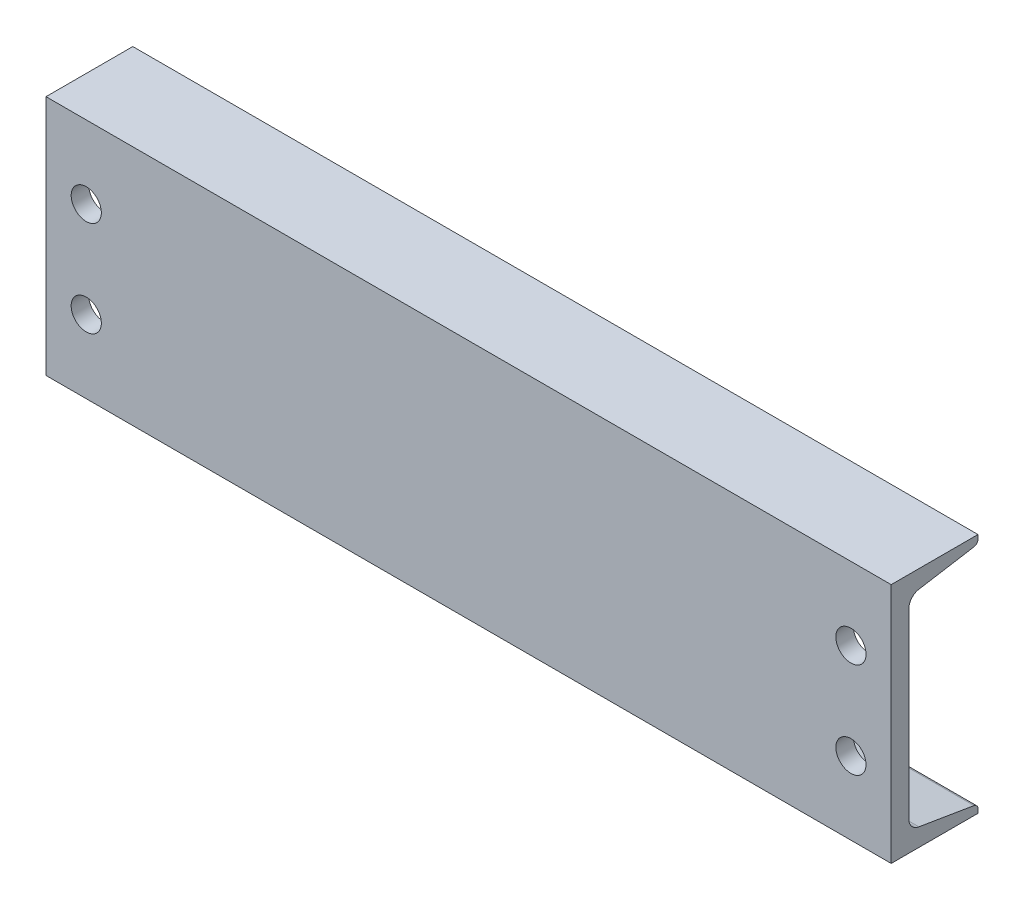
from build123d import *

# Parameters (mm, degrees)
BOSS_EXTRUDE1_DEPTH = 266.7
CUT_EXTRUDE1_REACH  = 284.731
SKETCH2_R           = 9.525
CUT_EXTRUDE2_REACH  = 310.391
SKETCH3_R           = 9.525


with BuildPart() as part:
    # Sketch1 → Boss-Extrude1 (new, symmetric)
    with BuildSketch(Plane(origin=(0, 0, 0), x_dir=(0, 0, -1), z_dir=(1, 0, 0))):
        with BuildLine():
            Line((-27.3939, -76.2), (-27.3939, 76.2))
            Line((-27.3939, 76.2), (27.3939, 76.2))
            Line((27.3939, 76.2), (27.3939, 73.710744653))
            ThreePointArc((27.3939, 73.710744653), (26.67159656, 71.740607726), (24.84702368, 70.704221901))
            Line((24.84702368, 70.704221901), (-9.926909199, 64.908143628))
            ThreePointArc((-9.926909199, 64.908143628), (-14.488341399, 62.317179067), (-16.2941, 57.391836749))
            Line((-16.2941, 57.391836749), (-16.2941, -57.391836749))
            ThreePointArc((-16.2941, -57.391836749), (-14.488341399, -62.317179067), (-9.926909199, -64.908143628))
            Line((-9.926909199, -64.908143628), (24.84702368, -70.704221901))
            ThreePointArc((24.84702368, -70.704221901), (26.67159656, -71.740607726), (27.3939, -73.710744653))
            Line((27.3939, -73.710744653), (27.3939, -76.2))
            Line((27.3939, -76.2), (-27.3939, -76.2))
        make_face()
    extrude(amount=BOSS_EXTRUDE1_DEPTH, both=True)

    # Sketch2 → Cut-Extrude1 (cut, up to next)
    with BuildSketch(Plane.XY.offset(27.3939), mode=Mode.PRIVATE) as cut_extrude1_sk1:
        with Locations((-241.3, 30.1625)):
            Circle(SKETCH2_R)
    cut_extrude1_tool1 = extrude(cut_extrude1_sk1.sketch, amount=-CUT_EXTRUDE1_REACH, mode=Mode.PRIVATE) & part.part
    # Sketch2 → Cut-Extrude1 (cut, up to next)
    with BuildSketch(Plane.XY.offset(27.3939), mode=Mode.PRIVATE) as cut_extrude1_sk2:
        with Locations((-241.3, -30.1625)):
            Circle(SKETCH2_R)
    cut_extrude1_tool2 = extrude(cut_extrude1_sk2.sketch, amount=-CUT_EXTRUDE1_REACH, mode=Mode.PRIVATE) & part.part
    # Sketch2 → Cut-Extrude1 (cut, up to next)
    with BuildSketch(Plane.XY.offset(27.3939), mode=Mode.PRIVATE) as cut_extrude1_sk3:
        with Locations((241.3, -30.1625)):
            Circle(SKETCH2_R)
    cut_extrude1_tool3 = extrude(cut_extrude1_sk3.sketch, amount=-CUT_EXTRUDE1_REACH, mode=Mode.PRIVATE) & part.part
    # Sketch2 → Cut-Extrude1 (cut, up to next)
    with BuildSketch(Plane.XY.offset(27.3939), mode=Mode.PRIVATE) as cut_extrude1_sk4:
        with Locations((241.3, 30.1625)):
            Circle(SKETCH2_R)
    cut_extrude1_tool4 = extrude(cut_extrude1_sk4.sketch, amount=-CUT_EXTRUDE1_REACH, mode=Mode.PRIVATE) & part.part
    add(cut_extrude1_tool1.solids().sort_by_distance((-241.3, 30.1625, 27.3939))[0], mode=Mode.SUBTRACT)
    add(cut_extrude1_tool2.solids().sort_by_distance((-241.3, -30.1625, 27.3939))[0], mode=Mode.SUBTRACT)
    add(cut_extrude1_tool3.solids().sort_by_distance((241.3, -30.1625, 27.3939))[0], mode=Mode.SUBTRACT)
    add(cut_extrude1_tool4.solids().sort_by_distance((241.3, 30.1625, 27.3939))[0], mode=Mode.SUBTRACT)

    # Sketch3 → Cut-Extrude2 (cut, up to next)
    with BuildSketch(Plane.XZ.offset(76.2), mode=Mode.PRIVATE) as cut_extrude2_sk1:
        with Locations((-152.4, -10.7061)):
            Circle(SKETCH3_R)
    cut_extrude2_tool1 = extrude(cut_extrude2_sk1.sketch, amount=-CUT_EXTRUDE2_REACH, mode=Mode.PRIVATE) & part.part
    # Sketch3 → Cut-Extrude2 (cut, up to next)
    with BuildSketch(Plane.XZ.offset(76.2), mode=Mode.PRIVATE) as cut_extrude2_sk2:
        with Locations((152.4, -10.7061)):
            Circle(SKETCH3_R)
    cut_extrude2_tool2 = extrude(cut_extrude2_sk2.sketch, amount=-CUT_EXTRUDE2_REACH, mode=Mode.PRIVATE) & part.part
    add(cut_extrude2_tool1.solids().sort_by_distance((-152.4, -76.2, -10.7061))[0], mode=Mode.SUBTRACT)
    add(cut_extrude2_tool2.solids().sort_by_distance((152.4, -76.2, -10.7061))[0], mode=Mode.SUBTRACT)


solid = part.part
